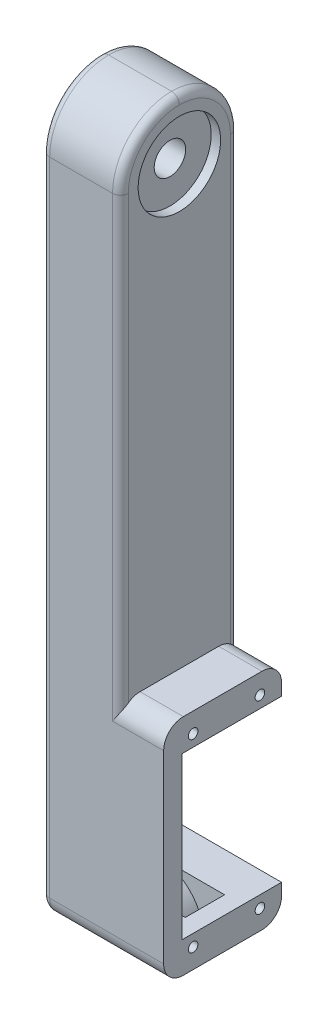
from build123d import *

# Parameters (mm, degrees)
SKETCH1_W                 = 20
SKETCH1_H                 = 30
BOSS_EXTRUDE1_DEPTH       = 183.3
SKETCH13_W                = 30
SKETCH13_H                = 57
BOSS_EXTRUDE2_DEPTH       = 11
SKETCH3_W                 = 20.6
SKETCH3_H                 = 41
CUT_EXTRUDE1_DEPTH        = 40
SKETCH11_R                = 10.5
CUT_EXTRUDE4_DEPTH        = 2.4
SKETCH12_R                = 4
CUT_EXTRUDE5_DEPTH        = 185.752943143
SKETCH14_W                = 31
SKETCH14_H                = 41
CUT_EXTRUDE6_DEPTH        = 25.3
F_2_CLEARANCE_HOLE2_D     = 2.4384
F_2_CLEARANCE_HOLE2_DEPTH = 6.35
F_2_CLEARANCE_HOLE2_TIP   = 0.732569267
CUT_EXTRUDE8_START        = -2
CUT_EXTRUDE8_DEPTH        = 1.6
F_2_CLEARANCE_HOLE3_D     = 2.4384
F_2_CLEARANCE_HOLE3_DEPTH = 6.35
F_2_CLEARANCE_HOLE3_TIP   = 0.732569267
FILLET3_R                 = 15
FILLET4_R                 = 5
FILLET5_R                 = 2
SKETCH21_W                = 6
SKETCH21_H                = 10
CUT_EXTRUDE9_DEPTH        = 8
FILLET6_R                 = 12
FILLET7_R                 = 6
CUT_EXTRUDE10_START       = -2
CUT_EXTRUDE10_DEPTH       = 1.9


# Some blends are built 0.0001 mm under size
with BuildPart() as part:
    # Sketch1 → Boss-Extrude1 (new body)
    with BuildSketch(Plane(origin=(0, 0, 0), x_dir=(1, 0, 0), z_dir=(0, 1, 0))):
        Rectangle(SKETCH1_W, SKETCH1_H)
    extrude(amount=BOSS_EXTRUDE1_DEPTH)

    # Sketch13 → Boss-Extrude2 (add)
    with BuildSketch(Plane.ZY.offset(-10)):
        with Locations((0, 28.5)):
            Rectangle(SKETCH13_W, SKETCH13_H)
    extrude(amount=-BOSS_EXTRUDE2_DEPTH)

    # Sketch3 → Cut-Extrude1 (cut)
    with BuildSketch(Plane(origin=(21, 0, 0), x_dir=(0, 0, -1), z_dir=(1, 0, 0))):
        with Locations((0, 28.5)):
            Rectangle(SKETCH3_W, SKETCH3_H)
    extrude(amount=-CUT_EXTRUDE1_DEPTH, mode=Mode.SUBTRACT)

    # Sketch11 → Cut-Extrude4 (cut)
    with BuildSketch(Plane.ZY.offset(-10)):
        with Locations((0, 168.3)):
            Circle(SKETCH11_R)
    extrude(amount=CUT_EXTRUDE4_DEPTH, mode=Mode.SUBTRACT)

    # Sketch12 → Cut-Extrude5 (cut, through all)
    with BuildSketch(Plane(origin=(7.6, 0, 0), x_dir=(0, 0, -1), z_dir=(1, 0, 0))):
        with Locations((0, 168.3)):
            Circle(SKETCH12_R)
    extrude(amount=-CUT_EXTRUDE5_DEPTH, mode=Mode.SUBTRACT)

    # Sketch14 → Cut-Extrude6 (cut)
    with BuildSketch(Plane(origin=(0, 0, -15), x_dir=(-1, 0, 0), z_dir=(0, 0, -1))):
        with Locations((-5.5, 28.5)):
            Rectangle(SKETCH14_W, SKETCH14_H)
    extrude(amount=-CUT_EXTRUDE6_DEPTH, mode=Mode.SUBTRACT)

    # #2 Clearance Hole2
    with Locations(Plane(origin=(21, 0, 0), x_dir=(0, 0, -1), z_dir=(1, 0, 0))):
        with Locations((-7.5, 5), (9.5, 5), (-7.5, 52), (9.5, 52)):
            Hole(F_2_CLEARANCE_HOLE2_D / 2, depth=F_2_CLEARANCE_HOLE2_DEPTH)
            with Locations((0, 0, -(F_2_CLEARANCE_HOLE2_DEPTH + F_2_CLEARANCE_HOLE2_TIP / 2))):  # 118° drill point
                Cone(0, F_2_CLEARANCE_HOLE2_D / 2, F_2_CLEARANCE_HOLE2_TIP, mode=Mode.SUBTRACT)

    # Sketch18 → Cut-Extrude8 (cut)
    with BuildSketch(Plane(origin=(21, 0, 0), x_dir=(0, 0, -1), z_dir=(1, 0, 0)).offset(CUT_EXTRUDE8_START)):
        Polygon((-10.329016319, 5), (-8.91450816, 2.55), (-6.08549184, 2.55), (-4.670983681, 5), (-6.08549184, 7.45), (-8.91450816, 7.45), align=None)
        Polygon((12.329016319, 5), (10.91450816, 7.45), (8.08549184, 7.45), (6.670983681, 5), (8.08549184, 2.55), (10.91450816, 2.55), align=None)
        Polygon((6.670983681, 52), (8.08549184, 49.55), (10.91450816, 49.55), (12.329016319, 52), (10.91450816, 54.45), (8.08549184, 54.45), align=None)
        Polygon((-4.670983681, 52), (-6.08549184, 54.45), (-8.91450816, 54.45), (-10.329016319, 52), (-8.91450816, 49.55), (-6.08549184, 49.55), align=None)
    extrude(amount=-CUT_EXTRUDE8_DEPTH, mode=Mode.SUBTRACT)

    # #2 Clearance Hole3
    with Locations(Plane(origin=(-10, 0, 0), x_dir=(0, 0, -1), z_dir=(-1, 0, 0))):
        with Locations((8.22, -4.1), (-3.52, -4.1), (-3.52, -52.9), (8.22, -52.9)):
            Hole(F_2_CLEARANCE_HOLE3_D / 2, depth=F_2_CLEARANCE_HOLE3_DEPTH)
            with Locations((0, 0, -(F_2_CLEARANCE_HOLE3_DEPTH + F_2_CLEARANCE_HOLE3_TIP / 2))):  # 118° drill point
                Cone(0, F_2_CLEARANCE_HOLE3_D / 2, F_2_CLEARANCE_HOLE3_TIP, mode=Mode.SUBTRACT)

    # Fillet3
    fillet3_edges = [part.edges().sort_by_distance(p)[0] for p in [
        (0, 183.3, 15),
        (0, 183.3, -15),
    ]]
    fillet(fillet3_edges, radius=FILLET3_R - 0.0001)  # a hair under: the kernel refuses the full size

    # Fillet4
    fillet4_edges = [part.edges().sort_by_distance(p)[0] for p in [
        (15.5, 57, -15),
        (15.5, 57, 15),
        (5.5, 0, -15),
        (5.5, 0, 15),
    ]]
    fillet(fillet4_edges, radius=FILLET4_R)

    # Fillet5
    fillet5_edges = [part.edges().sort_by_distance(p)[0] for p in [
        (10, 110.15005, 15),
        (10, 110.15005, -15),
        (10, 178.906631007, -10.606631007),
        (10, 178.906631007, 10.606631007),
        (-10, 86.65005, 15),
        (-10, 108.65005, -15),
        (-10, 178.906631007, -10.606631007),
        (-10, 178.906631007, 10.606631007),
        (-10, 0, 0),
        (-10, 1.464466094, -13.535533906),
        (-10, 1.464466094, 13.535533906),
        (-10, 6.5, -15),
    ]]
    fillet(fillet5_edges, radius=FILLET5_R)

    # Sketch21 → Cut-Extrude9 (cut)
    with BuildSketch(Plane.XZ):
        with Locations((13.5, 0)):
            Rectangle(SKETCH21_W, SKETCH21_H)
    extrude(amount=-CUT_EXTRUDE9_DEPTH, mode=Mode.SUBTRACT)

    # Fillet6
    # the kernel refuses this fillet: 12 mm, written as the material it takes off along each edge
    with BuildSketch(Plane(origin=(10.5, 8, 5), x_dir=(-1, 0, 0), z_dir=(0, 0, -1))) as fillet6_piece_1:
        with BuildLine():
            CenterArc((11.313708499, -12), FILLET6_R, 90, 70.528779366)
            Line((0, -8), (0, 0))
            Line((0, 0), (11.313708499, 0))
        make_face()
    extrude(amount=10, mode=Mode.SUBTRACT)

    # Fillet7
    # the kernel refuses this fillet: 6 mm, written as the material it takes off along each edge
    with BuildSketch(Plane(origin=(16.5, 0, 5), x_dir=(0, 1, 0), z_dir=(-1, 0, 0))) as fillet7_piece_1_section:
        with BuildLine():
            CenterArc((FILLET7_R, -FILLET7_R), FILLET7_R, 90, 90)
            Line((0, -FILLET7_R), (0, 0))
            Line((0, 0), (FILLET7_R, 0))
        make_face()
    fillet7_piece_1 = extrude(amount=21, mode=Mode.PRIVATE)
    fillet7_piece_1 = fillet7_piece_1 - Plane(origin=(-0.813708499, -4, 5.004149899), x_dir=(-1, 0, 0), z_dir=(0, 0, 1)) * Cylinder(12, 66, mode=Mode.PRIVATE)
    add(fillet7_piece_1, mode=Mode.SUBTRACT)

    # Sketch22 → Cut-Extrude10 (cut)
    with BuildSketch(Plane.ZY.offset(10).offset(CUT_EXTRUDE10_START)):
        Polygon((0.690983681, 52.9), (2.10549184, 50.45), (4.93450816, 50.45), (6.349016319, 52.9), (4.93450816, 55.35), (2.10549184, 55.35), align=None)
        Polygon((-11.049016319, 52.9), (-9.63450816, 50.45), (-6.80549184, 50.45), (-5.390983681, 52.9), (-6.80549184, 55.35), (-9.63450816, 55.35), align=None)
        Polygon((-5.390983681, 4.1), (-6.80549184, 6.55), (-9.63450816, 6.55), (-11.049016319, 4.1), (-9.63450816, 1.65), (-6.80549184, 1.65), align=None)
        Polygon((6.349016319, 4.1), (4.93450816, 6.55), (2.10549184, 6.55), (0.690983681, 4.1), (2.10549184, 1.65), (4.93450816, 1.65), align=None)
    extrude(amount=-CUT_EXTRUDE10_DEPTH, mode=Mode.SUBTRACT)


solid = part.part
